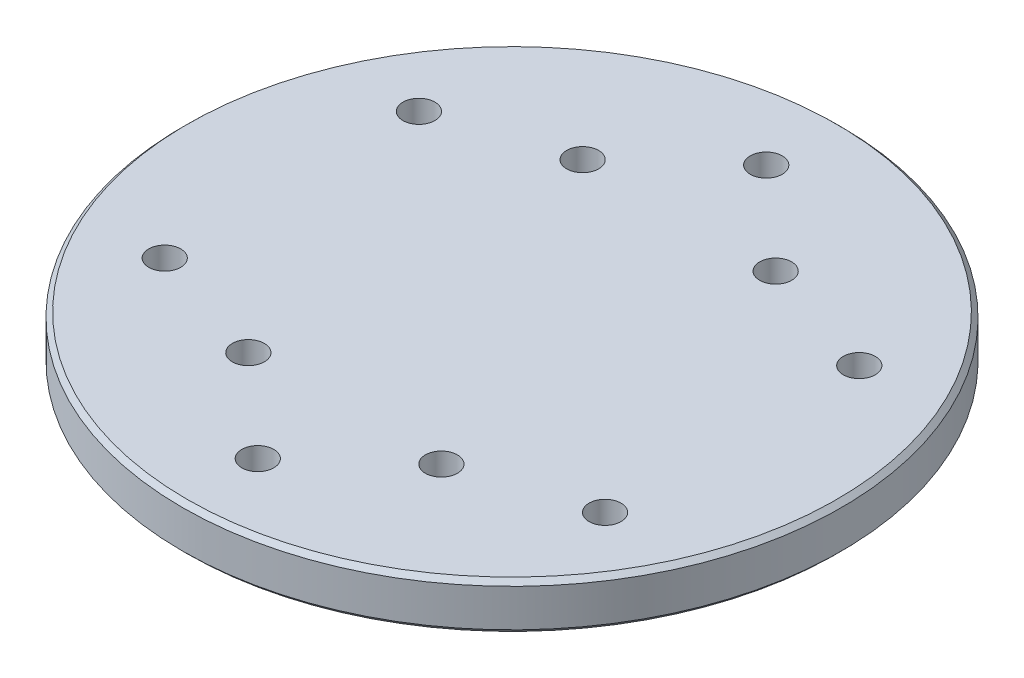
from build123d import *

# Parameters (mm, degrees)
SKETCH1_R           = 70
BOSS_EXTRUDE1_DEPTH = 10
CHAMFER1_SIZE       = 1
SKETCH2_R           = 3.4
CUT_EXTRUDE1_DEPTH  = 100.498743711


with BuildPart() as part:
    # Sketch1 → Boss-Extrude1 (new body)
    with BuildSketch(Plane(origin=(0, 0, 0), x_dir=(1, 0, 0), z_dir=(0, 1, 0))):
        Circle(SKETCH1_R)
    extrude(amount=BOSS_EXTRUDE1_DEPTH)

    # Chamfer1
    chamfer1_edges = [part.edges().sort_by_distance(p)[0] for p in [
        (-70, 0, 0),
        (-70, 10, 0),
    ]]
    chamfer(chamfer1_edges, length=CHAMFER1_SIZE)

    # Sketch2 → Cut-Extrude1 (cut, through all)
    with BuildSketch(Plane(origin=(0, 10, 0), x_dir=(1, 0, 0), z_dir=(0, 1, 0))):
        with Locations((0, 54)):
            Circle(SKETCH2_R)
        with Locations((46.765371804, 27)):
            Circle(SKETCH2_R)
        with Locations((46.765371804, -27)):
            Circle(SKETCH2_R)
        with Locations((0, -54)):
            Circle(SKETCH2_R)
        with Locations((-46.765371804, -27)):
            Circle(SKETCH2_R)
        with Locations((-46.765371804, 27)):
            Circle(SKETCH2_R)
        with Locations((-20.5, 35.5)):
            Circle(SKETCH2_R)
        with Locations((20.5, -35.5)):
            Circle(SKETCH2_R)
        with Locations((-20.5, -35.5)):
            Circle(SKETCH2_R)
        with Locations((20.5, 35.5)):
            Circle(SKETCH2_R)
    extrude(amount=-CUT_EXTRUDE1_DEPTH, mode=Mode.SUBTRACT)


solid = part.part
